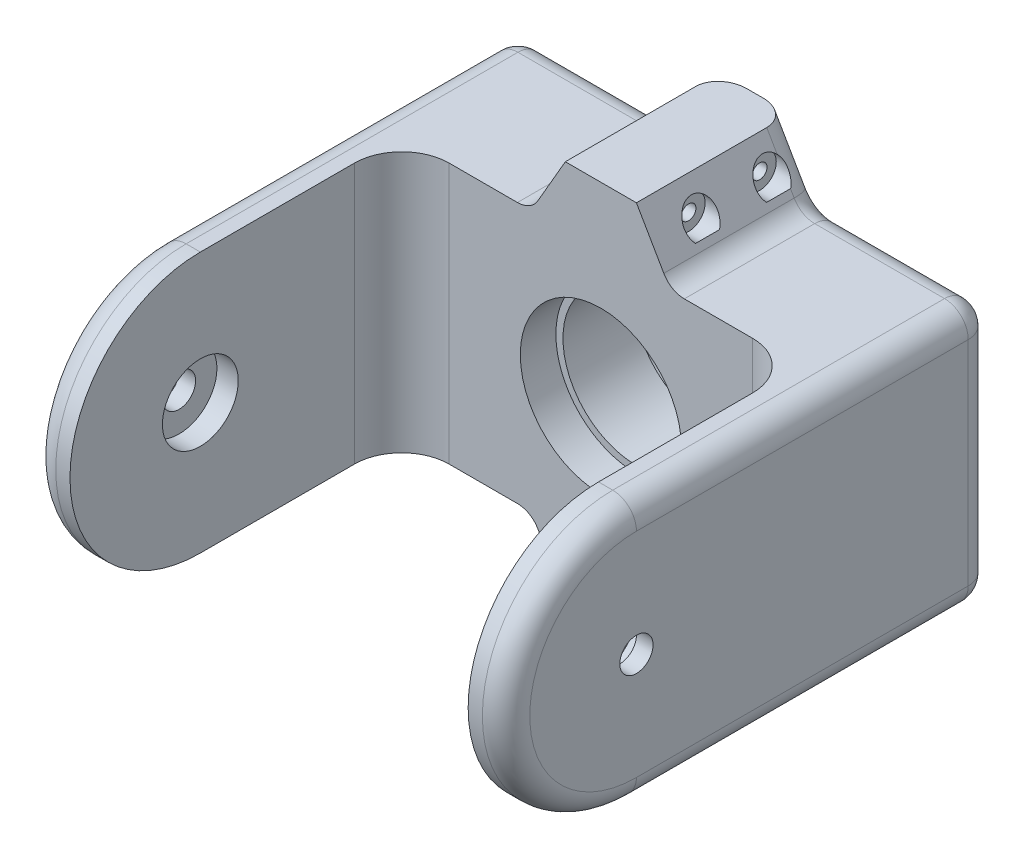
from build123d import *

# Parameters (mm, degrees)
SKETCH1_R                 = 34
SKETCH1_R_2               = 31
CENTRE_HOLE_FOR_L2_DEPTH  = 30
MAIN_STRUCTURE_DEPTH      = 100
MAIN_STRUCTURE_DEPTH_BACK = 50
SKETCH2_W                 = 200
SKETCH2_H                 = 110
SKETCH2_R                 = 34
BEARING_CURVE_DEPTH       = 16
SKETCH6_R                 = 7
CUT_EXTRUDE2_DEPTH        = 16
WRIST_CUTOUT_DEPTH        = 238.328885726
SKETCH9_R                 = 16
CUT_EXTRUDE3_DEPTH        = 9
FILLET2_R                 = 10
BOSS_EXTRUDE4_DEPTH       = 65
SKETCH11_R                = 3.1
CUT_EXTRUDE6_DEPTH        = 226
CUT_EXTRUDE8_START        = 25
SKETCH13_R                = 7
CUT_EXTRUDE8_DEPTH        = 8
FILLET3_R                 = 10
FILLET1_R                 = 10


with BuildPart() as part:
    # Sketch1 → Centre Hole for L2 (new body)
    with BuildSketch(Plane.XY):
        Circle(SKETCH1_R)
        Circle(SKETCH1_R_2, mode=Mode.SUBTRACT)
    extrude(amount=CENTRE_HOLE_FOR_L2_DEPTH)


with BuildPart() as body_2:
    # Sketch2 → Main Structure (new, two sides: drawn at the far end of the back side and taken through both)
    with BuildSketch(Plane.XY.offset(30).offset(-MAIN_STRUCTURE_DEPTH_BACK)):
        Rectangle(SKETCH2_W, SKETCH2_H)
        Circle(SKETCH2_R, mode=Mode.SUBTRACT)
    extrude(amount=MAIN_STRUCTURE_DEPTH + MAIN_STRUCTURE_DEPTH_BACK)

    # Sketch3 → Bearing Curve (add)
    with BuildSketch(Plane.ZY.offset(100)):
        with BuildLine():
            Line((130, 55), (130, -55))
            ThreePointArc((130, -55), (185, 0), (130, 55))
        make_face()
    bearing_curve = extrude(amount=-BEARING_CURVE_DEPTH)

    # Mirror7: Bearing Curve across plane
    add(bearing_curve.mirror(Plane(origin=(0, 0, 0), x_dir=(0, 0, 1), z_dir=(1, 0, 0))))

    # Sketch6 → Cut-Extrude2 (cut)
    with BuildSketch(Plane.ZY.offset(100)):
        with Locations((130, 0)):
            Circle(SKETCH6_R)
    cut_extrude2 = extrude(amount=-CUT_EXTRUDE2_DEPTH, mode=Mode.SUBTRACT)

    # Sketch4 → Wrist Cutout (cut, through all)
    with BuildSketch(Plane(origin=(0, 55, 0), x_dir=(1, 0, 0), z_dir=(0, 1, 0))):
        with BuildLine():
            Line((-84, -130), (-84, -65))
            ThreePointArc((-84, -65), (-78.142135624, -50.857864376), (-64, -45))
            Line((-64, -45), (64, -45))
            ThreePointArc((64, -45), (78.142135624, -50.857864376), (84, -65))
            Line((84, -65), (84, -130))
            Line((84, -130), (-84, -130))
        make_face()
    extrude(amount=-WRIST_CUTOUT_DEPTH, mode=Mode.SUBTRACT)

    # Sketch9 → Cut-Extrude3 (cut)
    with BuildSketch(Plane(origin=(-84, 0, 0), x_dir=(0, 0, -1), z_dir=(1, 0, 0))):
        with Locations((-130, 0)):
            Circle(SKETCH9_R)
    cut_extrude3 = extrude(amount=-CUT_EXTRUDE3_DEPTH, mode=Mode.SUBTRACT)

    # Mirror6: Cut-Extrude2, Cut-Extrude3 across plane
    add(cut_extrude2.mirror(Plane(origin=(0, 0, 0), x_dir=(0, 0, 1), z_dir=(1, 0, 0))), mode=Mode.SUBTRACT)
    add(cut_extrude3.mirror(Plane(origin=(0, 0, 0), x_dir=(0, 0, 1), z_dir=(1, 0, 0))), mode=Mode.SUBTRACT)

    # Fillet2
    fillet2_edges = [body_2.edges().sort_by_distance(p)[0] for p in [
        (-100, 0, -20),
        (100, 0, -20),
    ]]
    fillet(fillet2_edges, radius=FILLET2_R)

    # Sketch10 → Boss-Extrude4 (add)
    with BuildSketch(Plane(origin=(0, 0, -20), x_dir=(-1, 0, 0), z_dir=(0, 0, -1))):
        Polygon((15, 80), (-15, 80), (-29.43375673, 55), (29.43375673, 55), align=None)
    boss_extrude4 = extrude(amount=-BOSS_EXTRUDE4_DEPTH)

    # Sketch11 → Cut-Extrude6 (cut, symmetric)
    with BuildSketch(Plane(origin=(0, 0, 0), x_dir=(0, 0, -1), z_dir=(1, 0, 0))):
        with Locations(Location((5, 67.5, 0), (0, 0, 90))):
            Circle(SKETCH11_R)
        with Locations(Location((-25, 67.5, 0), (0, 0, 90))):
            Circle(SKETCH11_R)
    cut_extrude6 = extrude(amount=CUT_EXTRUDE6_DEPTH, both=True, mode=Mode.SUBTRACT)

    # Sketch13 → Cut-Extrude8 (cut)
    with BuildSketch(Plane(origin=(0, 0, 0), x_dir=(0, 0, -1), z_dir=(1, 0, 0)).offset(CUT_EXTRUDE8_START)):
        with Locations((5, 67.5)):
            Circle(SKETCH13_R)
        with Locations((-25, 67.5)):
            Circle(SKETCH13_R)
    cut_extrude8 = extrude(amount=-CUT_EXTRUDE8_DEPTH, mode=Mode.SUBTRACT)

    # Mirror8: Boss-Extrude4, Cut-Extrude6, Cut-Extrude8 across plane
    add(boss_extrude4.mirror(Plane.ZX))
    add(cut_extrude6.mirror(Plane.ZX), mode=Mode.SUBTRACT)
    add(cut_extrude8.mirror(Plane.ZX), mode=Mode.SUBTRACT)

    # Fillet3
    fillet3_edges = [body_2.edges().sort_by_distance(p)[0] for p in [
        (-29.43375673, 55, 12.5),
        (29.43375673, 55, 12.5),
        (29.43375673, -55, 12.5),
        (-29.43375673, -55, 12.5),
    ]]
    fillet(fillet3_edges, radius=FILLET3_R)

    # Fillet1
    # the kernel refuses this fillet: 10 mm, written as the material it takes off along each edge
    with BuildSketch(Plane(origin=(-100, 55, 130), x_dir=(1, 0, 0), z_dir=(0, 0, -1))) as fillet1_piece_1:
        with BuildLine():
            CenterArc((FILLET1_R, FILLET1_R), FILLET1_R, 180, 90)
            Line((0, FILLET1_R), (0, 0))
            Line((0, 0), (FILLET1_R, 0))
        make_face()
    extrude(amount=140, mode=Mode.SUBTRACT)
    with BuildSketch(Plane(origin=(-100, -55, -10), x_dir=(0, 1, 0), z_dir=(0, 0, 1)), Plane(origin=(100, -55, -10), x_dir=(-1, 0, 0), z_dir=(0, 0, 1)), Plane(origin=(100, 55, 130), x_dir=(-1, 0, 0), z_dir=(0, 0, -1))) as fillet1_piece_2:
        with BuildLine():
            CenterArc((FILLET1_R, -FILLET1_R), FILLET1_R, 90, 90)
            Line((0, -FILLET1_R), (0, 0))
            Line((0, 0), (FILLET1_R, 0))
        make_face()
    extrude(amount=140, mode=Mode.SUBTRACT)
    with BuildSketch(Plane(origin=(-100, 0, 130), x_dir=(0, -1, 0), z_dir=(0, 0, -1))) as fillet1_piece_3:
        with BuildLine():
            CenterArc((55 - FILLET1_R, -FILLET1_R), FILLET1_R, 0, 90)
            Line((55, -FILLET1_R), (55, 0))
            Line((55, 0), (55 - FILLET1_R, 0))
        make_face()
    revolve(axis=Axis((-100, 0, 130), (-1, 0, 0)), revolution_arc=180, mode=Mode.SUBTRACT)
    with BuildSketch(Plane(origin=(-26.547005384, -60, -20), x_dir=(0.8660254037844384, 0.5000000000000004, 0), z_dir=(0.5000000000000004, -0.8660254037844384, 0)), Plane(origin=(2.5, -101.650635095, -20), x_dir=(-0.8660254037844399, 0.49999999999999767, 0), z_dir=(0.4999999999999977, 0.86602540378444, 0))) as fillet1_piece_4:
        with BuildLine():
            CenterArc((FILLET1_R, FILLET1_R), FILLET1_R, 180, 90)
            Line((0, FILLET1_R), (0, 0))
            Line((0, 0), (FILLET1_R, 0))
        make_face()
    extrude(amount=48.094010768, mode=Mode.SUBTRACT)
    with BuildSketch(Plane(origin=(-35.207259422, -65, -20), x_dir=(0, 1, 0), z_dir=(-1, 0, 0))) as fillet1_piece_5:
        with BuildLine():
            CenterArc((10 + FILLET1_R, -FILLET1_R), FILLET1_R, 90, 90)
            Line((10, -FILLET1_R), (10, 0))
            Line((10, 0), (10 + FILLET1_R, 0))
        make_face()
    revolve(axis=Axis((-35.207259422, -65, -20), (0, 0, -1)), revolution_arc=60, mode=Mode.SUBTRACT)
    with BuildSketch(Plane(origin=(-90, -55, -20), x_dir=(0, 1, 0), z_dir=(1, 0, 0)), Plane(origin=(90, 55, -20), x_dir=(0, -1, 0), z_dir=(-1, 0, 0)), Plane(origin=(35.207259422, -55, -20), x_dir=(0, 1, 0), z_dir=(1, 0, 0))) as fillet1_piece_6:
        with BuildLine():
            CenterArc((FILLET1_R, FILLET1_R), FILLET1_R, 180, 90)
            Line((0, FILLET1_R), (0, 0))
            Line((0, 0), (FILLET1_R, 0))
        make_face()
    extrude(amount=54.792740578, mode=Mode.SUBTRACT)
    with BuildSketch(Plane(origin=(-90, -55, -10), x_dir=(-1, 0, 0), z_dir=(0, 0, 1))) as fillet1_piece_7:
        with BuildLine():
            CenterArc((10 - FILLET1_R, -FILLET1_R), FILLET1_R, 0, 90)
            Line((10 - FILLET1_R, 0), (10, 0))
            Line((10, 0), (10, -FILLET1_R))
        make_face()
    revolve(axis=Axis((-90, -55, -10), (0, -1, 0)), revolution_arc=90, mode=Mode.SUBTRACT)
    with BuildSketch(Plane(origin=(-26.547005384, 60, -20), x_dir=(0.8660254037844384, -0.5000000000000004, 0), z_dir=(0.5000000000000004, 0.8660254037844384, 0)), Plane(origin=(2.5, 101.650635095, -20), x_dir=(-0.8660254037844399, -0.49999999999999767, 0), z_dir=(0.4999999999999977, -0.86602540378444, 0))) as fillet1_piece_8:
        with BuildLine():
            CenterArc((FILLET1_R, -FILLET1_R), FILLET1_R, 90, 90)
            Line((0, -FILLET1_R), (0, 0))
            Line((0, 0), (FILLET1_R, 0))
        make_face()
    extrude(amount=48.094010768, mode=Mode.SUBTRACT)
    with BuildSketch(Plane(origin=(-35.207259422, 65, -20), x_dir=(0, -1, 0), z_dir=(-1, 0, 0))) as fillet1_piece_9:
        with BuildLine():
            CenterArc((10 + FILLET1_R, FILLET1_R), FILLET1_R, 180, 90)
            Line((10, FILLET1_R), (10, 0))
            Line((10, 0), (10 + FILLET1_R, 0))
        make_face()
    revolve(axis=Axis((-35.207259422, 65, -20), (0, 0, 1)), revolution_arc=60, mode=Mode.SUBTRACT)
    with BuildSketch(Plane(origin=(-35.207259422, 55, -20), x_dir=(0, 0, 1), z_dir=(-1, 0, 0))) as fillet1_piece_10:
        with BuildLine():
            CenterArc((FILLET1_R, -FILLET1_R), FILLET1_R, 90, 90)
            Line((0, -FILLET1_R), (0, 0))
            Line((0, 0), (FILLET1_R, 0))
        make_face()
    extrude(amount=54.792740578, mode=Mode.SUBTRACT)
    with BuildSketch(Plane(origin=(-90, 55, -10), x_dir=(-1, 0, 0), z_dir=(0, 0, 1))) as fillet1_piece_11:
        with BuildLine():
            CenterArc((10 - FILLET1_R, FILLET1_R), FILLET1_R, 270, 90)
            Line((10, FILLET1_R), (10, 0))
            Line((10, 0), (10 - FILLET1_R, 0))
        make_face()
    revolve(axis=Axis((-90, 55, -10), (0, -1, 0)), revolution_arc=90, mode=Mode.SUBTRACT)
    with BuildSketch(Plane(origin=(35.207259422, 65, -20), x_dir=(0, -1, 0), z_dir=(1, 0, 0))) as fillet1_piece_12:
        with BuildLine():
            CenterArc((10 + FILLET1_R, -FILLET1_R), FILLET1_R, 90, 90)
            Line((10, -FILLET1_R), (10, 0))
            Line((10, 0), (10 + FILLET1_R, 0))
        make_face()
    revolve(axis=Axis((35.207259422, 65, -20), (0, 0, -1)), revolution_arc=60, mode=Mode.SUBTRACT)
    with BuildSketch(Plane(origin=(90, 55, -10), x_dir=(0, 0, -1), z_dir=(-1, 0, 0))) as fillet1_piece_13:
        with BuildLine():
            CenterArc((10 - FILLET1_R, FILLET1_R), FILLET1_R, 270, 90)
            Line((10 - FILLET1_R, 0), (10, 0))
            Line((10, 0), (10, FILLET1_R))
        make_face()
    revolve(axis=Axis((90, 55, -10), (0, -1, 0)), revolution_arc=90, mode=Mode.SUBTRACT)
    with BuildSketch(Plane(origin=(35.207259422, -65, -20), x_dir=(-0.8660254037844398, 0.49999999999999795, 0), z_dir=(-0.49999999999999795, -0.8660254037844398, 0))) as fillet1_piece_14:
        with BuildLine():
            CenterArc((10 + FILLET1_R, -FILLET1_R), FILLET1_R, 90, 90)
            Line((10, -FILLET1_R), (10, 0))
            Line((10, 0), (10 + FILLET1_R, 0))
        make_face()
    revolve(axis=Axis((35.207259422, -65, -20), (0, 0, -1)), revolution_arc=60, mode=Mode.SUBTRACT)
    with BuildSketch(Plane(origin=(90, -55, -10), x_dir=(0, 0, -1), z_dir=(-1, 0, 0))) as fillet1_piece_15:
        with BuildLine():
            CenterArc((10 - FILLET1_R, -FILLET1_R), FILLET1_R, 0, 90)
            Line((10, -FILLET1_R), (10, 0))
            Line((10, 0), (10 - FILLET1_R, 0))
        make_face()
    revolve(axis=Axis((90, -55, -10), (0, -1, 0)), revolution_arc=90, mode=Mode.SUBTRACT)
    with BuildSketch(Plane(origin=(100, 0, 130), x_dir=(0, -1, 0), z_dir=(0, 0, -1))) as fillet1_piece_16:
        with BuildLine():
            CenterArc((55 - FILLET1_R, FILLET1_R), FILLET1_R, 270, 90)
            Line((55, FILLET1_R), (55, 0))
            Line((55, 0), (55 - FILLET1_R, 0))
        make_face()
    revolve(axis=Axis((100, 0, 130), (-1, 0, 0)), revolution_arc=180, mode=Mode.SUBTRACT)


solid = Compound([part.part, body_2.part])
